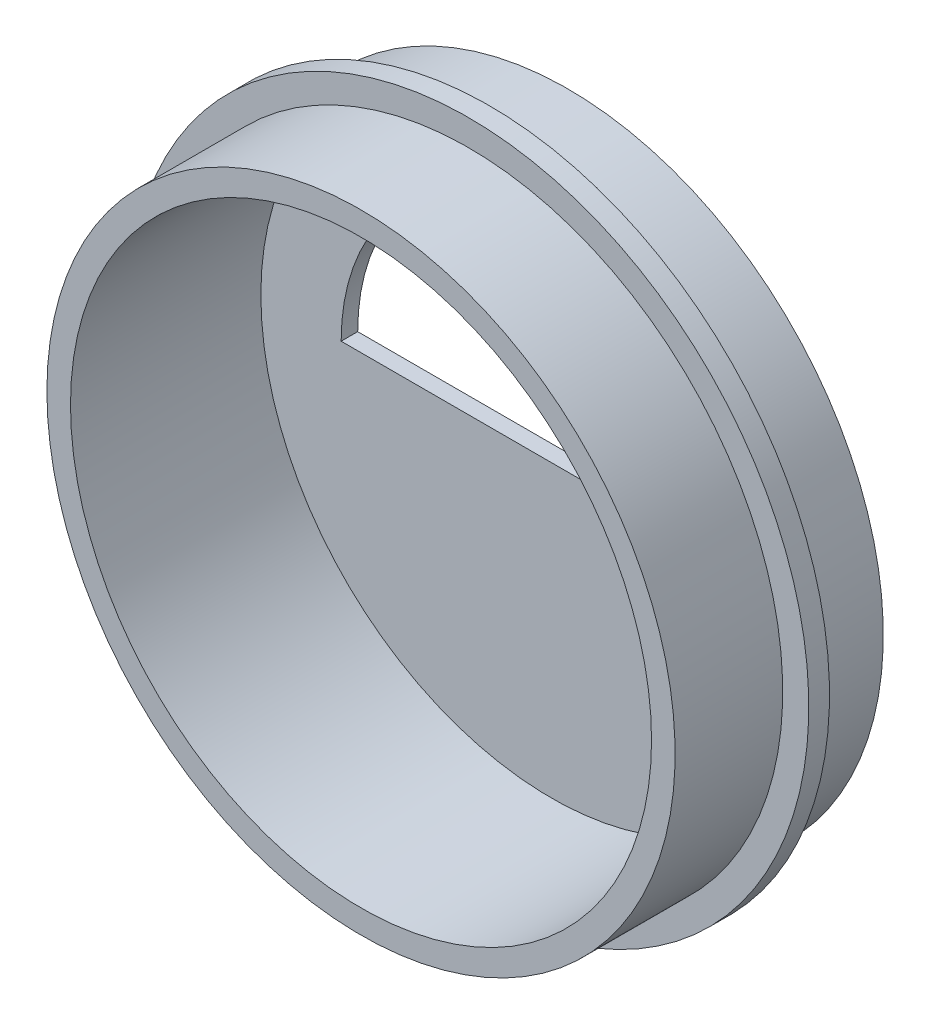
from build123d import *

# Parameters (mm, degrees)
BOSS_EXTRUDE1_START = -2
BOSS_EXTRUDE1_DEPTH = 2


with BuildPart() as part:
    # Sketch6 → Revolve1 (revolve)
    with BuildSketch(Plane(origin=(0, 0, 0), x_dir=(0, 0, -1), z_dir=(1, 0, 0))):
        Polygon((0, 25.4), (-2, 25.4), (-2, 35.1), (-25, 35.1), (-25, 37.95), (-12, 37.95), (-12, 41.1), (-9.5, 41.1), (-9.5, 38.1), (0, 38.1), align=None)
    revolve(axis=Axis((0, 0, 0), (0, 0, 1)))

    # Sketch7 → Boss-Extrude1 (add)
    with BuildSketch(Plane(origin=(0, 0, 0), x_dir=(-1, 0, 0), z_dir=(0, 0, -1)).offset(BOSS_EXTRUDE1_START)):
        with BuildLine():
            Line((-25.4, 0), (25.4, 0))
            ThreePointArc((25.4, 0), (0, -25.4), (-25.4, 0))
        make_face()
    extrude(amount=BOSS_EXTRUDE1_DEPTH)


solid = part.part
